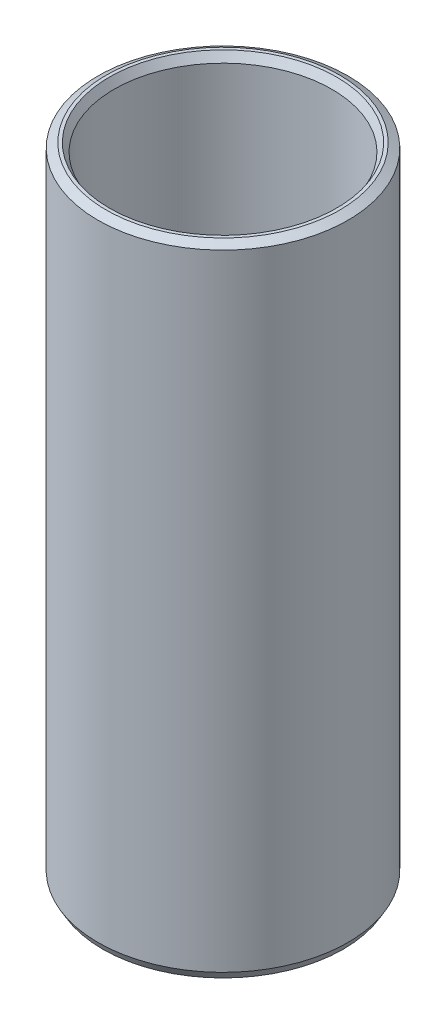
from build123d import *
from OCP.BRepFilletAPI import BRepFilletAPI_MakeChamfer

# Parameters (mm, degrees)
SKETCH1_R           = 42.5
BOSS_EXTRUDE1_DEPTH = 217.003758313
SKETCH2_R           = 37.012200261
CUT_EXTRUDE1_DEPTH  = 226.173557777
CHAMFER1_SIZE       = 1.609006297
CHAMFER1_SIZE2      = 2.786880656


with BuildPart() as part:
    # Sketch1 → Boss-Extrude1 (new body)
    with BuildSketch(Plane(origin=(0, 0, 0), x_dir=(1, 0, 0), z_dir=(0, 1, 0))):
        Circle(SKETCH1_R)
    extrude(amount=BOSS_EXTRUDE1_DEPTH)

    # Sketch2 → Cut-Extrude1 (cut, through all)
    with BuildSketch(Plane(origin=(0, 0, 0), x_dir=(1, 0, 0), z_dir=(0, 1, 0))):
        Circle(SKETCH2_R)
    extrude(amount=CUT_EXTRUDE1_DEPTH, mode=Mode.SUBTRACT)

    # Chamfer1: one chamfer whose edges measure the first distance from different faces: ONE call of the kernel's chamfer builder (chamfer() names one face for all edges)
    chamfer1_edges_1 = [part.edges().sort_by_distance(p)[0] for p in [
        (-37.012200261, 217.003758313, 0),
    ]]
    chamfer1_side_1 = [part.faces().sort_by_distance(p)[0] for p in [
        (-41.297918472, 217.003758313, 0),
    ]]
    chamfer1_edges_2 = [part.edges().sort_by_distance(p)[0] for p in [
        (-37.012200261, 0, 0),
    ]]
    chamfer1_side_2 = [part.faces().sort_by_distance(p)[0] for p in [
        (-37.012200261, 108.501879156, 0),
    ]]
    chamfer1_edges_3 = [part.edges().sort_by_distance(p)[0] for p in [
        (-42.5, 0, 0),
    ]]
    chamfer1_side_3 = [part.faces().sort_by_distance(p)[0] for p in [
        (-41.297918472, 0, 0),
    ]]
    chamfer1_edges_4 = [part.edges().sort_by_distance(p)[0] for p in [
        (-42.5, 217.003758313, 0),
    ]]
    chamfer1_side_4 = [part.faces().sort_by_distance(p)[0] for p in [
        (-42.5, 108.501879156, 0),
    ]]
    chamfer1 = BRepFilletAPI_MakeChamfer(part.part.solid().wrapped)
    for e in chamfer1_edges_1:
        chamfer1.Add(CHAMFER1_SIZE, CHAMFER1_SIZE2, e.wrapped, chamfer1_side_1[0].wrapped)  # the first distance lies on this face
    for e in chamfer1_edges_2:
        chamfer1.Add(CHAMFER1_SIZE, CHAMFER1_SIZE2, e.wrapped, chamfer1_side_2[0].wrapped)  # the first distance lies on this face
    for e in chamfer1_edges_3:
        chamfer1.Add(CHAMFER1_SIZE, CHAMFER1_SIZE2, e.wrapped, chamfer1_side_3[0].wrapped)  # the first distance lies on this face
    for e in chamfer1_edges_4:
        chamfer1.Add(CHAMFER1_SIZE, CHAMFER1_SIZE2, e.wrapped, chamfer1_side_4[0].wrapped)  # the first distance lies on this face
    add(Compound.cast(chamfer1.Shape()), mode=Mode.REPLACE)


solid = part.part
